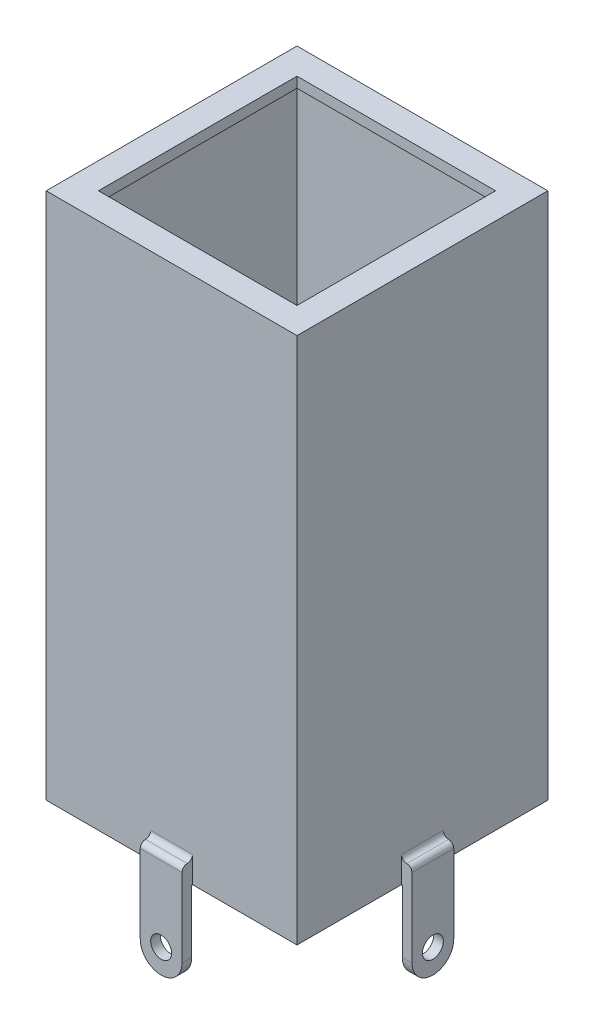
from build123d import *

# Parameters (mm, degrees)
SKETCH1_W             = 38.1
SKETCH1_H             = 38.1
SKETCH1_W_2           = 34.925
SKETCH1_H_2           = 34.925
BOSS_EXTRUDE1_DEPTH   = 78.58125
SKETCH2_W             = 38.1
SKETCH2_H             = 38.1
SKETCH2_W_2           = 30.1625
SKETCH2_H_2           = 30.1625
BOSS_EXTRUDE2_DEPTH   = 1.5875
SKETCH3_W             = 1.5875
SKETCH3_H             = 6.35
BOSS_EXTRUDE3_DEPTH   = 12.7
SKETCH3_W_2           = 6.35
SKETCH3_H_2           = 1.5875
BOSS_EXTRUDE3_2_DEPTH = 12.7
BOSS_EXTRUDE3_3_DEPTH = 12.7
BOSS_EXTRUDE3_4_DEPTH = 12.7
SKETCH4_R             = 1.5875
CUT_EXTRUDE3_DEPTH    = 50.8
SKETCH5_R             = 1.5875
CUT_EXTRUDE4_DEPTH    = 50.8
SKETCH6_W             = 6.35
SKETCH6_H             = 1.5875
SKETCH6_W_2           = 1.5875
SKETCH6_H_2           = 6.35
BOSS_EXTRUDE4_DEPTH   = 3.175
FILLET3_R             = 0.79375
FILLET4_R             = 3.175
SKETCH7_W             = 38.354
SKETCH7_H             = 38.354
CUT_EXTRUDE5_DEPTH    = 25.4


with BuildPart() as part:
    # Sketch1 → Boss-Extrude1 (new body)
    with BuildSketch(Plane(origin=(0, 0, 0), x_dir=(1, 0, 0), z_dir=(0, 1, 0))):
        Rectangle(SKETCH1_W, SKETCH1_H)
        Rectangle(SKETCH1_W_2, SKETCH1_H_2, mode=Mode.SUBTRACT)
    extrude(amount=BOSS_EXTRUDE1_DEPTH)

    # Sketch2 → Boss-Extrude2 (add)
    with BuildSketch(Plane(origin=(0, 78.58125, 0), x_dir=(1, 0, 0), z_dir=(0, 1, 0))):
        Rectangle(SKETCH2_W, SKETCH2_H)
        Rectangle(SKETCH2_W_2, SKETCH2_H_2, mode=Mode.SUBTRACT)
    extrude(amount=BOSS_EXTRUDE2_DEPTH)



with BuildPart() as body_2:
    # Sketch3 → Boss-Extrude3 (new body)
    with BuildSketch(Plane.XZ):
        with Locations((-19.84375, 0)):
            Rectangle(SKETCH3_W, SKETCH3_H)
    extrude(amount=BOSS_EXTRUDE3_DEPTH)


with BuildPart() as body_3:
    # Sketch3 → Boss-Extrude3 2 (new body)
    with BuildSketch(Plane.XZ):
        with Locations((0, 19.84375)):
            Rectangle(SKETCH3_W_2, SKETCH3_H_2)
    extrude(amount=BOSS_EXTRUDE3_2_DEPTH)


with BuildPart() as body_4:
    # Sketch3 → Boss-Extrude3 3 (new body)
    with BuildSketch(Plane.XZ):
        with Locations((19.84375, 0)):
            Rectangle(SKETCH3_W, SKETCH3_H)
    extrude(amount=BOSS_EXTRUDE3_3_DEPTH)


with BuildPart() as body_5:
    # Sketch3 → Boss-Extrude3 4 (new body)
    with BuildSketch(Plane.XZ):
        with Locations((0, -19.84375)):
            Rectangle(SKETCH3_W_2, SKETCH3_H_2)
    extrude(amount=BOSS_EXTRUDE3_4_DEPTH)


with BuildPart() as cut_extrude3_tool:
    # Sketch4 → Cut-Extrude3 (new body)
    with BuildSketch(Plane.XY.offset(20.6375)):
        with Locations((0, -9.017)):
            Circle(SKETCH4_R)
    extrude(amount=-CUT_EXTRUDE3_DEPTH)


with BuildPart() as body_3_1:
    add(body_3.part)

    # Cut-Extrude3: cut by cut_extrude3_tool
    add(cut_extrude3_tool.part, mode=Mode.SUBTRACT)


with BuildPart() as body_5_1:
    add(body_5.part)

    # Cut-Extrude3: cut by cut_extrude3_tool
    add(cut_extrude3_tool.part, mode=Mode.SUBTRACT)


with BuildPart() as cut_extrude4_tool:
    # Sketch5 → Cut-Extrude4 (new body)
    with BuildSketch(Plane(origin=(20.6375, 0, 0), x_dir=(0, 0, -1), z_dir=(1, 0, 0))):
        with Locations((0, -9.017)):
            Circle(SKETCH5_R)
    extrude(amount=-CUT_EXTRUDE4_DEPTH)


with BuildPart() as body_2_1:
    add(body_2.part)

    # Cut-Extrude4: cut by cut_extrude4_tool
    add(cut_extrude4_tool.part, mode=Mode.SUBTRACT)


with BuildPart() as body_4_1:
    add(body_4.part)

    # Cut-Extrude4: cut by cut_extrude4_tool
    add(cut_extrude4_tool.part, mode=Mode.SUBTRACT)


with BuildPart() as part_1:
    add(part.part)

    add(body_2_1.part)  # Boss-Extrude4 merges body 2

    add(body_3_1.part)  # Boss-Extrude4 merges body 3

    add(body_4_1.part)  # Boss-Extrude4 merges body 4

    add(body_5_1.part)  # Boss-Extrude4 merges body 5
    # Sketch6 → Boss-Extrude4 (add)
    with BuildSketch(Plane(origin=(0, 0, 0), x_dir=(1, 0, 0), z_dir=(0, 1, 0))):
        with Locations((0, 19.84375)):
            Rectangle(SKETCH6_W, SKETCH6_H)
        with Locations((19.84375, 0)):
            Rectangle(SKETCH6_W_2, SKETCH6_H_2)
        with Locations((0, -19.84375)):
            Rectangle(SKETCH6_W, SKETCH6_H)
        with Locations((-19.84375, 0)):
            Rectangle(SKETCH6_W_2, SKETCH6_H_2)
    extrude(amount=BOSS_EXTRUDE4_DEPTH)

    # Fillet3
    fillet3_edges = [part_1.edges().sort_by_distance(p)[0] for p in [
        (-19.05, 3.175, 0),
        (0, 3.175, -19.05),
        (19.05, 3.175, 0),
        (0, 3.175, 19.05),
    ]]
    fillet(fillet3_edges, radius=FILLET3_R)
    fillet3_2_edges = [part_1.edges().sort_by_distance(p)[0] for p in [
        (-20.6375, 3.175, 0),
        (0, 3.175, -20.6375),
        (20.6375, 3.175, 0),
        (0, 3.175, 20.6375),
    ]]
    fillet(fillet3_2_edges, radius=FILLET3_R - 0.0001)  # a hair under: the kernel refuses the full size

    # Fillet4
    fillet4_edges = [part_1.edges().sort_by_distance(p)[0] for p in [
        (3.175, -12.7, -19.84375),
        (-3.175, -12.7, -19.84375),
        (19.84375, -12.7, -3.175),
        (19.84375, -12.7, 3.175),
        (3.175, -12.7, 19.84375),
        (-3.175, -12.7, 19.84375),
        (-19.84375, -12.7, 3.175),
        (-19.84375, -12.7, -3.175),
    ]]
    fillet(fillet4_edges, radius=FILLET4_R - 0.0001)  # a hair under: the kernel refuses the full size

    # Sketch7 → Cut-Extrude5 (cut)
    with BuildSketch(Plane.XZ):
        Rectangle(SKETCH7_W, SKETCH7_H)
    extrude(amount=CUT_EXTRUDE5_DEPTH, mode=Mode.SUBTRACT)


solid = part_1.part
